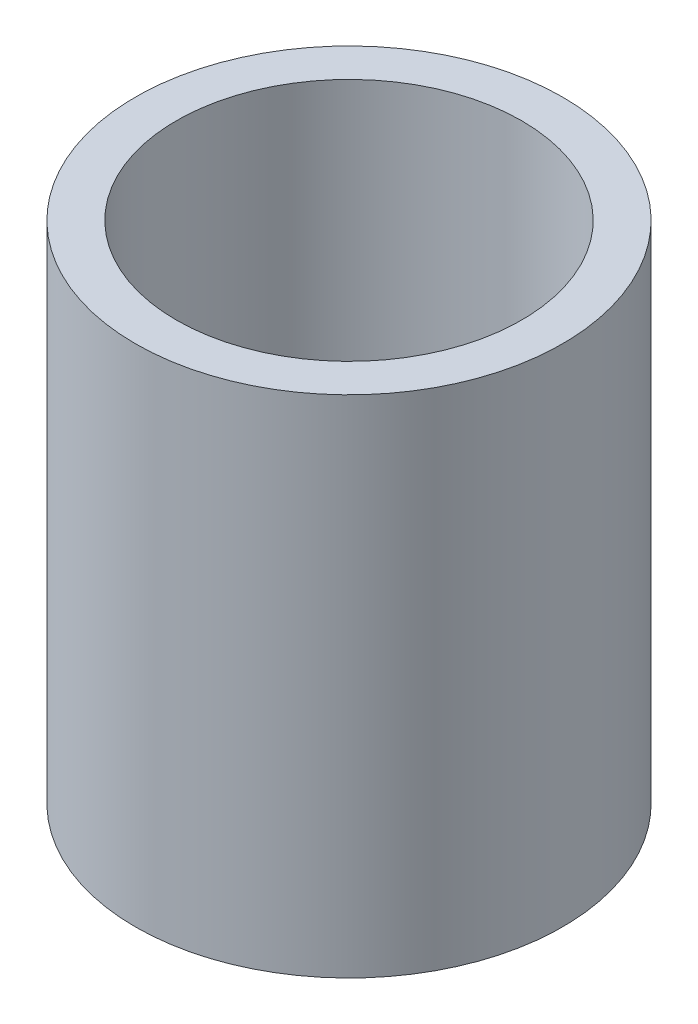
from build123d import *

# Parameters (mm, degrees)
SKETCH1_R           = 7.825
SKETCH1_R_2         = 6.325
BOSS_EXTRUDE1_DEPTH = 12.75
BOSS_EXTRUDE2_START = -5.75
SKETCH1_2_R         = 7.825
BOSS_EXTRUDE2_DEPTH = 5.75
CUT_EXTRUDE2_DEPTH  = 5.75


with BuildPart() as part:
    # Sketch1 → Boss-Extrude1 (new body)
    with BuildSketch(Plane(origin=(0, 0, 0), x_dir=(1, 0, 0), z_dir=(0, 1, 0))):
        Circle(SKETCH1_R)
        Circle(SKETCH1_R_2, mode=Mode.SUBTRACT)
    extrude(amount=BOSS_EXTRUDE1_DEPTH)

    # Sketch1<2> → Boss-Extrude2 (add)
    with BuildSketch(Plane(origin=(0, 0, 0), x_dir=(1, 0, 0), z_dir=(0, 1, 0)).offset(BOSS_EXTRUDE2_START)):
        Circle(SKETCH1_2_R)
    extrude(amount=BOSS_EXTRUDE2_DEPTH)

    # Sketch2 → Cut-Extrude2 (cut)
    with BuildSketch(Plane.XZ.offset(5.75)):
        with BuildLine():
            Line((2.005772918, 1.45), (-2.005772918, 1.45))
            ThreePointArc((-2.005772918, 1.45), (-2.475, 0), (-2.005772918, -1.45))
            Line((-2.005772918, -1.45), (2.005772918, -1.45))
            ThreePointArc((2.005772918, -1.45), (2.475, 0), (2.005772918, 1.45))
        make_face()
    extrude(amount=-CUT_EXTRUDE2_DEPTH, mode=Mode.SUBTRACT)


solid = part.part
